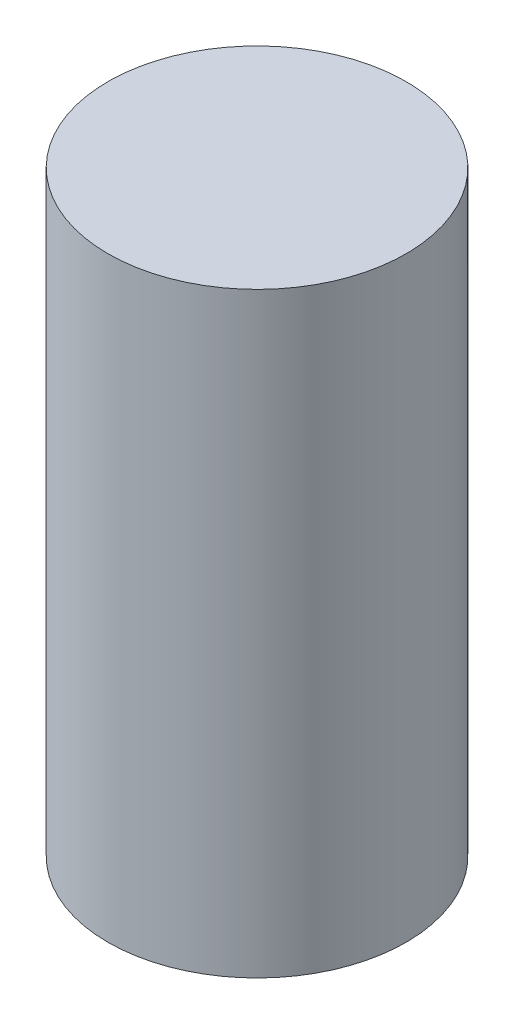
from build123d import *

# Parameters (mm, degrees)
SKETCH_1_R      = 30
EXTRUDE_1_DEPTH = 120


with BuildPart() as part:
    # 草图1 → 凸台-拉伸1 (new body)
    with BuildSketch(Plane(origin=(0, 0, 0), x_dir=(1, 0, 0), z_dir=(0, 1, 0))):
        Circle(SKETCH_1_R)
    extrude(amount=EXTRUDE_1_DEPTH)


solid = part.part
